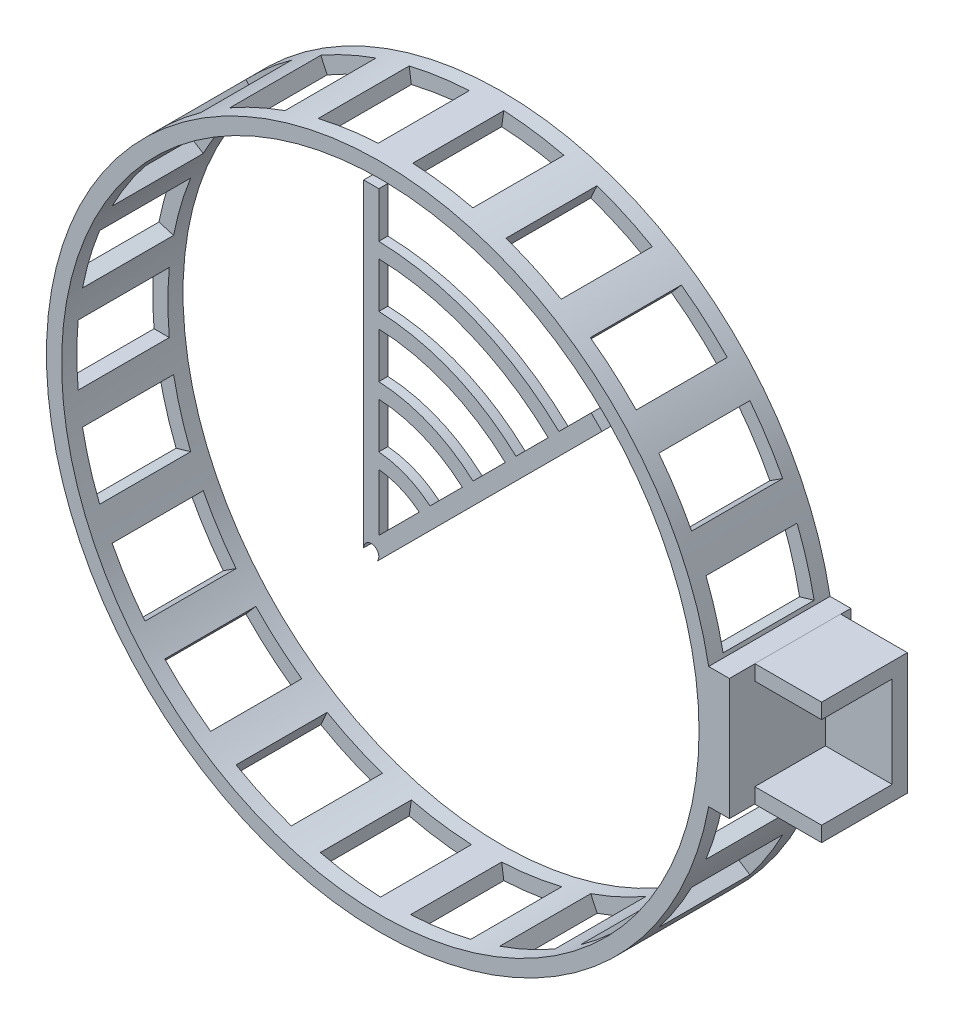
from build123d import *
from build123d.topology import SkipClean

# Parameters (mm, degrees)
ESQUISSE1_R                  = 110
ESQUISSE1_R_2                = 105
BOSS_EXTRU_1_DEPTH           = 40
ESQUISSE3_W                  = 30
ESQUISSE3_H                  = 20
ENL_V_MAT_EXTRU_1_DEPTH      = 250.198715888
R_P_TITION_CIRCULAIRE1_COUNT = 22
BOSS_EXTRU_4_REACH           = 255.624
BOSS_EXTRU_4_END_RADIUS      = 110
ESQUISSE9_W                  = 40
ESQUISSE9_H                  = 40
BOSS_EXTRU_22_DEPTH          = 22
BOSS_EXTRU_9_REACH           = 251.199
BOSS_EXTRU_9_END_RADIUS      = 105
ESQUISSE14_W                 = 30
ESQUISSE14_H                 = 20
BOSS_EXTRU_13_DEPTH          = 3


with BuildPart() as part:
    # Esquisse1 → Boss.-Extru.1 (new body)
    with BuildSketch(Plane.XY):
        Circle(ESQUISSE1_R)
        Circle(ESQUISSE1_R_2, mode=Mode.SUBTRACT)
    extrude(amount=BOSS_EXTRU_1_DEPTH)

    # Esquisse3 → Enlèv. mat.-Extru.1 (cut, through all)
    with BuildSketch(Plane(origin=(110, 0, 0), x_dir=(0, 0, -1), z_dir=(1, 0, 0))):
        with Locations((-20, 0)):
            Rectangle(ESQUISSE3_W, ESQUISSE3_H)
    enl_v_mat_extru_1 = extrude(amount=-ENL_V_MAT_EXTRU_1_DEPTH, mode=Mode.SUBTRACT)

    # Répétition circulaire1: Enlèv. mat.-Extru.1 ×22 about axis
    r_p_tition_circulaire1_axis = Axis((0, 0, -2), (0, 0, 1))
    for i in range(1, R_P_TITION_CIRCULAIRE1_COUNT):
        add(enl_v_mat_extru_1.rotate(r_p_tition_circulaire1_axis, i * 360 / R_P_TITION_CIRCULAIRE1_COUNT), mode=Mode.SUBTRACT)

    # Boss.-Extru.4: up to this cylinder (the profile starts outside it)
    boss_extru_4_end = Plane(origin=(0, 0, 20), z_dir=(0, 0, -1)) * Cylinder(BOSS_EXTRU_4_END_RADIUS, 732.248, mode=Mode.PRIVATE)
    # Esquisse9 → Boss.-Extru.4 (add, up to the surface)
    with BuildSketch(Plane(origin=(115, 0, 0), x_dir=(0, 0, -1), z_dir=(1, 0, 0)), mode=Mode.PRIVATE) as boss_extru_4_sk1:
        with Locations((-20, 0)):
            Rectangle(ESQUISSE9_W, ESQUISSE9_H)
    boss_extru_4_tool1 = extrude(boss_extru_4_sk1.sketch, amount=-BOSS_EXTRU_4_REACH, mode=Mode.PRIVATE) - boss_extru_4_end
    add(boss_extru_4_tool1.solids().sort_by_distance((115, 0, 20))[0])

    # Esquisse24 → Boss.-Extru.22 (add)
    with BuildSketch(Plane(origin=(115, 0, 115), x_dir=(0, 0, 1), z_dir=(-1, 0, 0))):
        Polygon((-83.37, -15.05), (-106.63, -15.05), (-106.63, 15.05), (-83.37, 15.05), (-83.37, 20.05), (-111.63, 20.05), (-111.63, -20.05), (-83.37, -20.05), align=None)
    extrude(amount=-BOSS_EXTRU_22_DEPTH)

    # Boss.-Extru.9: up to this cylinder (the profile starts outside it)
    with SkipClean():  # the faces are left unmerged after this step: merging them gives an invalid solid
        boss_extru_9_end = Plane(origin=(0, 0, 20), z_dir=(0, 0, -1)) * Cylinder(BOSS_EXTRU_9_END_RADIUS, 713.398, mode=Mode.PRIVATE)
        # Esquisse14 → Boss.-Extru.9 (add, up to the surface)
        with BuildSketch(Plane(origin=(110, 0, 0), x_dir=(0, 0, -1), z_dir=(1, 0, 0)), mode=Mode.PRIVATE) as boss_extru_9_sk1:
            with Locations((-20, 0)):
                Rectangle(ESQUISSE14_W, ESQUISSE14_H)
        boss_extru_9_tool1 = extrude(boss_extru_9_sk1.sketch, amount=-BOSS_EXTRU_9_REACH, mode=Mode.PRIVATE) - boss_extru_9_end
        add(boss_extru_9_tool1.solids().sort_by_distance((110, 0, 20))[0])


with BuildPart() as body_2:
    # Esquisse15 → Boss.-Extru.13 (new body)
    with BuildSketch(Plane.XY.offset(40)):
        with BuildLine():
            ThreePointArc((2.5, 0), (2.309698831, -0.956708581), (1.767766953, -1.767766953))
            Line((1.767766953, -1.767766953), (75.992931149, 72.457397244))
            ThreePointArc((75.992931149, 72.457397244), (74.246212025, 74.246212025), (72.457397244, 75.992931149))
            Line((72.457397244, 75.992931149), (61.847286297, 65.382820203))
            ThreePointArc((61.847286297, 65.382820203), (34.441508913, 83.149157926), (2.5, 89.965271077))
            Line((2.5, 89.965271077), (2.5, 104.970233876))
            ThreePointArc((2.5, 104.970233876), (0, 105), (-2.5, 104.970233876))
            Line((-2.5, 104.970233876), (-2.5, 0))
            ThreePointArc((-2.5, 0), (0, 2.5), (2.5, 0))
        make_face()
        with BuildLine():
            Line((2.5, 6.035533906), (2.5, 24.874685928))
            ThreePointArc((2.5, 24.874685928), (9.567085809, 23.096988313), (15.821292146, 19.356826052))
            Line((15.821292146, 19.356826052), (2.5, 6.035533906))
        make_face(mode=Mode.SUBTRACT)
        with BuildLine():
            Line((30.002895615, 33.538429521), (19.371651204, 22.90718511))
            ThreePointArc((19.371651204, 22.90718511), (11.480502971, 27.716385975), (2.5, 29.895651858))
            Line((2.5, 29.895651858), (2.5, 44.930501889))
            ThreePointArc((2.5, 44.930501889), (17.220754456, 41.574578963), (30.002895615, 33.538429521))
        make_face(mode=Mode.SUBTRACT)
        with BuildLine():
            Line((44.160165724, 47.69569963), (33.543350277, 37.078884183))
            ThreePointArc((33.543350277, 37.078884183), (19.134171618, 46.193976626), (2.5, 49.937460889))
            Line((2.5, 49.937460889), (2.5, 64.951905284))
            ThreePointArc((2.5, 64.951905284), (24.874423104, 60.052169613), (44.160165724, 47.69569963))
        make_face(mode=Mode.SUBTRACT)
        with BuildLine():
            Line((58.310307251, 61.845841156), (47.698130391, 51.233664296))
            ThreePointArc((47.698130391, 51.233664296), (26.787840266, 64.671567276), (2.5, 69.955342898))
            Line((2.5, 69.955342898), (2.5, 84.96322734))
            ThreePointArc((2.5, 84.96322734), (32.528091751, 78.529760263), (58.310307251, 61.845841156))
        make_face(mode=Mode.SUBTRACT)
    extrude(amount=BOSS_EXTRU_13_DEPTH)


solid = Compound([part.part, body_2.part])
